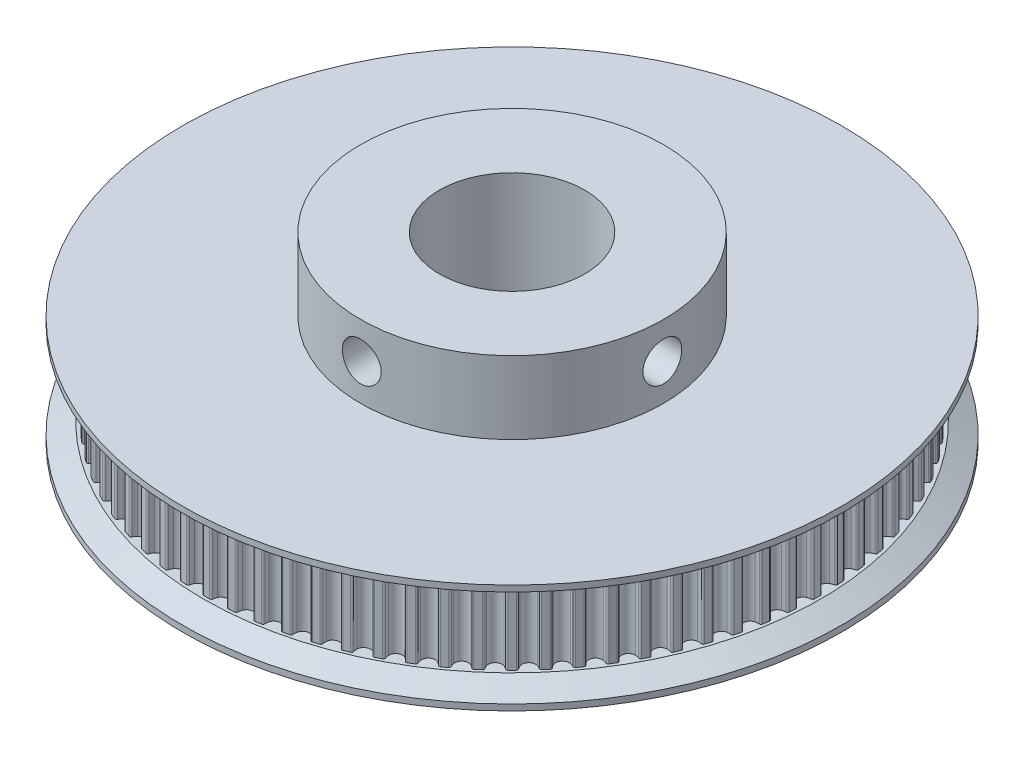
from build123d import *

# Parameters (mm, degrees)
SKETCH2_R           = 25.464790895
SKETCH2_R_2         = 6
BOSS_EXTRUDE1_DEPTH = 3
CUT_EXTRUDE3_DEPTH  = 37.137392693
CIRPATTERN3_COUNT   = 80
SKETCH4_W           = 6.5
SKETCH4_H           = 6
SKETCH5_R           = 1.6
CUT_EXTRUDE2_DEPTH  = 40.869617469
CIRPATTERN2_COUNT   = 2
CIRPATTERN2_ANGLE   = 90


with BuildPart() as part:
    # Sketch2 → Boss-Extrude1 (new, symmetric)
    with BuildSketch(Plane(origin=(0, 0, 0), x_dir=(1, 0, 0), z_dir=(0, 1, 0))):
        Circle(SKETCH2_R)
        Circle(SKETCH2_R_2, mode=Mode.SUBTRACT)
    extrude(amount=BOSS_EXTRUDE1_DEPTH, both=True)

    # Sketch6 → Cut-Extrude3 (cut, symmetric)
    with BuildSketch(Plane(origin=(0, 0, 0), x_dir=(1, 0, 0), z_dir=(0, 1, 0))):
        with BuildLine():
            Line((0, 25.200790895), (0, 25.840790895))
            ThreePointArc((0, 25.840790895), (1.01450469, 25.820868581), (2.027445086, 25.76113236))
            Line((2.027445086, 25.76113236), (1.977231265, 25.123105267))
            ThreePointArc((1.977231265, 25.123105267), (1.854239976, 25.132482087), (1.731204264, 25.141256801))
            ThreePointArc((1.731204264, 25.141256801), (1.635618784, 25.11208417), (1.583840246, 25.026605463))
            ThreePointArc((1.583840246, 25.026605463), (1.543516417, 24.873786704), (1.47984585, 24.72912972))
            ThreePointArc((1.47984585, 24.72912972), (0.959933546, 24.431940221), (0.464941176, 24.769005433))
            ThreePointArc((0.464941176, 24.769005433), (0.412816541, 24.918212023), (0.384607039, 25.073723464))
            ThreePointArc((0.384607039, 25.073723464), (0.339694699, 25.163001166), (0.246692735, 25.199583417))
            ThreePointArc((0.246692735, 25.199583417), (0.123347845, 25.200489024), (0, 25.200790895))
        make_face()
    cut_extrude3 = extrude(amount=CUT_EXTRUDE3_DEPTH, both=True, mode=Mode.SUBTRACT)

    # CirPattern3: Cut-Extrude3 ×80 about axis
    cirpattern3_axis = Axis((0, 3, 0), (0, -1, 0))
    for i in range(1, CIRPATTERN3_COUNT):
        add(cut_extrude3.rotate(cirpattern3_axis, i * 360 / CIRPATTERN3_COUNT), mode=Mode.SUBTRACT)

    # Sketch3 → Revolve1 (revolve)
    with BuildSketch(Plane.XY):
        Polygon((-25.464790895, 3), (-27.196841702, 4), (-27.196841702, 4.5), (-6, 4.5), (-6, 3), align=None)
    revolve1 = revolve(axis=Axis((0, 0, 0), (0, 1, 0)))

    # Mirror1: Revolve1 across plane
    add(revolve1.mirror(Plane.ZX))

    # Sketch4 → Revolve2 (revolve)
    with BuildSketch(Plane.XY):
        with Locations((-9.25, 7.5)):
            Rectangle(SKETCH4_W, SKETCH4_H)
    revolve(axis=Axis((0, 0, 0), (0, 1, 0)))

    # Sketch5 → Cut-Extrude2 (cut, through all)
    with BuildSketch(Plane.XY):
        with Locations((0, 7.5)):
            Circle(SKETCH5_R)
    cut_extrude2 = extrude(amount=CUT_EXTRUDE2_DEPTH, mode=Mode.SUBTRACT)

    # CirPattern2: Cut-Extrude2 ×2 about axis
    cirpattern2_axis = Axis((0, 3, 0), (0, 1, 0))
    for i in range(1, CIRPATTERN2_COUNT):
        add(cut_extrude2.rotate(cirpattern2_axis, i * CIRPATTERN2_ANGLE / (CIRPATTERN2_COUNT - 1)), mode=Mode.SUBTRACT)


solid = part.part
